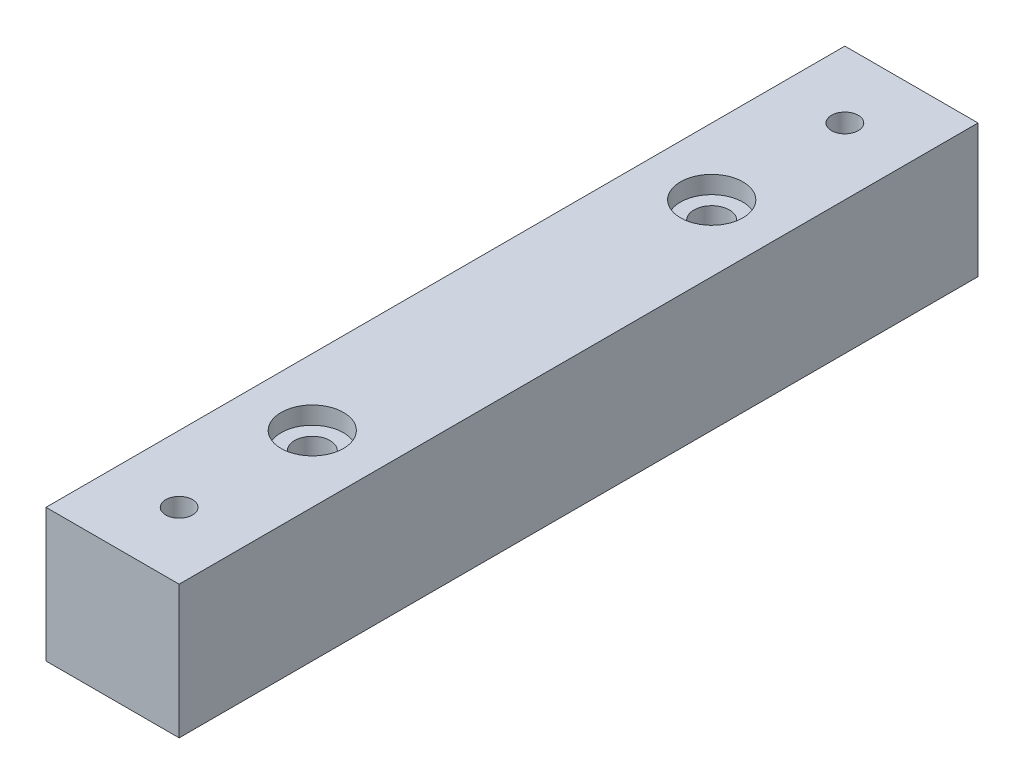
from build123d import *

# Parameters (mm, degrees)
SKETCH1_W                                        = 25.4
SKETCH1_H                                        = 25.4
BOSS_EXTRUDE1_DEPTH                              = 152.4
F_1_4_20_TAPPED_HOLE1_D                          = 5.1054
F_1_4_20_TAPPED_HOLE1_DEPTH                      = 19.1
F_1_4_20_TAPPED_HOLE1_TIP                        = 1.533816902
CBORE_FOR_1_4_BUTTON_HEAD_CAP_SCREW1_D           = 6.7564
CBORE_FOR_1_4_BUTTON_HEAD_CAP_SCREW1_CBORE_D     = 11.90752
CBORE_FOR_1_4_BUTTON_HEAD_CAP_SCREW1_CBORE_DEPTH = 3.3528


with BuildPart() as part:
    # Sketch1 → Boss-Extrude1 (new body)
    with BuildSketch(Plane.XY):
        Rectangle(SKETCH1_W, SKETCH1_H)
    extrude(amount=BOSS_EXTRUDE1_DEPTH)

    # 1/4-20 Tapped Hole1
    with Locations(Plane(origin=(0, 12.7, 12.7), x_dir=(0, 0, 1), z_dir=(0, 1, 0))):
        with Locations((0, 0), (127, 0)):
            Hole(F_1_4_20_TAPPED_HOLE1_D / 2, depth=F_1_4_20_TAPPED_HOLE1_DEPTH)
            with Locations((0, 0, -(F_1_4_20_TAPPED_HOLE1_DEPTH + F_1_4_20_TAPPED_HOLE1_TIP / 2))):  # 118° drill point
                Cone(0, F_1_4_20_TAPPED_HOLE1_D / 2, F_1_4_20_TAPPED_HOLE1_TIP, mode=Mode.SUBTRACT)

    # CBORE for 1/4 Button Head Cap Screw1 (through all)
    with Locations(Plane(origin=(0, 12.7, 38.1), x_dir=(0, 0, 1), z_dir=(0, 1, 0))):
        with Locations((0, 0), (76.2, 0)):
            CounterBoreHole(CBORE_FOR_1_4_BUTTON_HEAD_CAP_SCREW1_D / 2, CBORE_FOR_1_4_BUTTON_HEAD_CAP_SCREW1_CBORE_D / 2, CBORE_FOR_1_4_BUTTON_HEAD_CAP_SCREW1_CBORE_DEPTH)


solid = part.part
